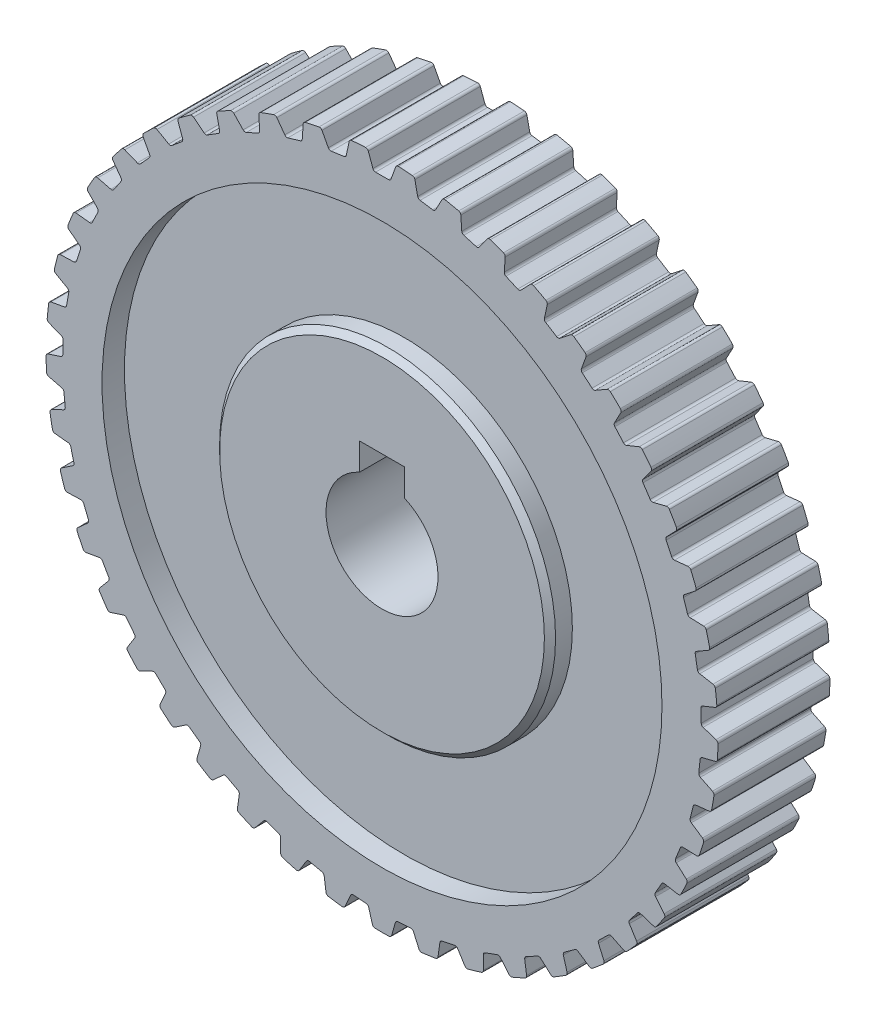
from build123d import *

# Parameters (mm, degrees)
SKETCH1_R               = 30
BOSS_EXTRUDE1_DEPTH     = 10
CUT_EXTRUDE1_DEPTH      = 44.588989435
CIRPATTERN1_COUNT       = 45
SKETCH3_R               = 25
SKETCH3_R_2             = 15
CUT_EXTRUDE_THIN1_DEPTH = 2
CHAMFER1_SIZE           = 0.5
CHAMFER2_SIZE           = 0.5
FILLET1_R               = 0.25


with BuildPart() as part:
    # Sketch1 → Boss-Extrude1 (new body)
    with BuildSketch(Plane.XY):
        Circle(SKETCH1_R)
        with BuildLine():
            Line((2, 7), (-2, 7))
            Line((-2, 7), (-2, 4.582575695))
            ThreePointArc((-2, 4.582575695), (0, -5), (2, 4.582575695))
            Line((2, 4.582575695), (2, 7))
        make_face(mode=Mode.SUBTRACT)
    extrude(amount=BOSS_EXTRUDE1_DEPTH)

    # Sketch2 → Cut-Extrude1 (cut, through all)
    with BuildSketch(Plane.XY.offset(10)):
        with BuildLine():
            Line((-0.75, 28.5), (0.75, 28.5))
            Line((0.75, 28.5), (1.285919783, 29.972427501))
            ThreePointArc((1.285919783, 29.972427501), (0, 30), (-1.285919783, 29.972427501))
            Line((-1.285919783, 29.972427501), (-0.75, 28.5))
        make_face()
    cut_extrude1 = extrude(amount=-CUT_EXTRUDE1_DEPTH, mode=Mode.SUBTRACT)

    # CirPattern1: Cut-Extrude1 ×45 about axis
    cirpattern1_axis = Axis((0, 0, 10), (0, 0, 1))
    for i in range(1, CIRPATTERN1_COUNT):
        add(cut_extrude1.rotate(cirpattern1_axis, i * 360 / CIRPATTERN1_COUNT), mode=Mode.SUBTRACT)

    # Sketch3 → Cut-Extrude-Thin1 (cut)
    with BuildSketch(Plane.XY.offset(10)):
        Circle(SKETCH3_R)
        Circle(SKETCH3_R_2, mode=Mode.SUBTRACT)
    cut_extrude_thin1 = extrude(amount=-CUT_EXTRUDE_THIN1_DEPTH, mode=Mode.SUBTRACT)

    # Chamfer1
    chamfer1_edges = [part.edges().sort_by_distance(p)[0] for p in [
        (-15, 0, 10),
    ]]
    chamfer(chamfer1_edges, length=CHAMFER1_SIZE)

    # Mirror1: Cut-Extrude-Thin1 across plane
    add(cut_extrude_thin1.mirror(Plane.XY.offset(5)), mode=Mode.SUBTRACT)

    # Chamfer2
    chamfer2_edges = [part.edges().sort_by_distance(p)[0] for p in [
        (-15, 0, 0),
    ]]
    chamfer(chamfer2_edges, length=CHAMFER2_SIZE)

    # Fillet1
    fillet1_edges = [part.edges().sort_by_distance(p)[0] for p in [
        (29.942650626, -1.854096408, 5),
        (29.999047061, -0.2391138, 5),
        (28.508813193, 0.245092536, 5),
        (28.456463948, 1.744178776, 5),
        (29.909291155, 2.33115907, 5),
        (29.740376607, 3.938273644, 5),
        (28.197257094, 4.210367249, 5),
        (27.936784828, 5.687578878, 5),
        (29.293781353, 6.471041187, 5),
        (28.90284355, 8.039007072, 5),
        (27.33687346, 8.093691952, 5),
        (26.873347969, 9.520276727, 5),
        (28.108101418, 10.484971849, 5),
        (27.502749521, 11.983270371, 5),
        (25.94440868, 11.819482149, 5),
        (25.286851959, 13.167673218, 5),
        (26.375329261, 14.29482446, 5),
        (25.567345756, 15.694292943, 5),
        (24.046965495, 15.31521957, 5),
        (23.20817614, 16.558775928, 5),
        (24.129191322, 17.826444573, 5),
        (23.134302688, 19.099843956, 5),
        (21.681475481, 18.512863662, 5),
        (20.677779571, 19.6275809, 5),
        (21.413406121, 21.01109322, 5),
        (20.250976734, 22.133638231, 5),
        (18.893980208, 21.350175922, 5),
        (17.744913544, 22.314357336, 5),
        (18.280833326, 23.786784837, 5),
        (16.973488552, 24.736626415, 5),
        (15.738735103, 23.771931292, 5),
        (14.466662959, 24.566810189, 5),
        (14.792444905, 26.099493745, 5),
        (13.365630723, 26.858144303, 5),
        (12.277153421, 25.730993061, 5),
        (10.906835234, 26.341098025, 5),
        (11.01613837, 27.904205694, 5),
        (9.497626095, 28.456898963, 5),
        (8.576610913, 27.189230317, 5),
        (7.134718369, 27.602686351, 5),
        (5.444760978, 29.501772453, 5),
        (4.709134429, 28.118260133, 5),
        (3.223732326, 28.327019785, 5),
        (2.897950379, 29.859703341, 5),
        (1.285919783, 29.972427501, 5),
        (0.75, 28.5, 5),
        (-0.75, 28.5, 5),
        (-1.285919783, 29.972427501, 5),
        (-2.897950379, 29.859703341, 5),
        (-3.223732326, 28.327019785, 5),
        (-4.709134429, 28.118260133, 5),
        (-5.444760978, 29.501772453, 5),
        (-7.025415233, 29.16579402, 5),
        (-7.134718369, 27.602686351, 5),
        (-8.576610913, 27.189230317, 5),
        (-9.497626095, 28.456898963, 5),
        (-11.01613837, 27.904205694, 5),
        (-10.906835234, 26.341098025, 5),
        (-12.277153421, 25.730993061, 5),
        (-13.365630723, 26.858144303, 5),
        (-14.792444905, 26.099493745, 5),
        (-14.466662959, 24.566810189, 5),
        (-15.738735103, 23.771931292, 5),
        (-16.973488552, 24.736626415, 5),
        (-18.280833326, 23.786784837, 5),
        (-17.744913544, 22.314357336, 5),
        (-18.893980208, 21.350175922, 5),
        (-20.250976734, 22.133638231, 5),
        (-21.413406121, 21.01109322, 5),
        (-20.677779571, 19.6275809, 5),
        (-21.681475481, 18.512863662, 5),
        (-23.134302688, 19.099843956, 5),
        (-24.129191322, 17.826444573, 5),
        (-23.20817614, 16.558775928, 5),
        (-24.046965495, 15.31521957, 5),
        (-25.567345756, 15.694292943, 5),
        (-26.375329261, 14.29482446, 5),
        (-25.286851959, 13.167673218, 5),
        (-25.94440868, 11.819482149, 5),
        (-27.502749521, 11.983270371, 5),
        (-28.108101418, 10.484971849, 5),
        (-26.873347969, 9.520276727, 5),
        (-27.33687346, 8.093691952, 5),
        (-28.90284355, 8.039007072, 5),
        (-29.293781353, 6.471041187, 5),
        (-27.936784828, 5.687578878, 5),
        (-28.197257094, 4.210367249, 5),
        (-29.740376607, 3.938273644, 5),
        (-29.909291155, 2.33115907, 5),
        (-28.456463948, 1.744178776, 5),
        (-28.508813193, 0.245092536, 5),
        (-29.999047061, -0.2391138, 5),
        (-29.942650626, -1.854096408, 5),
        (-28.422270365, -2.233169782, 5),
        (-28.265477671, -3.724952625, 5),
        (-29.673820188, -4.411847167, 5),
        (-29.393210462, -6.003264007, 5),
        (-27.834869621, -6.16705223, 5),
        (-27.471986777, -7.622495819, 5),
        (-28.771026159, -8.498708946, 5),
        (-28.27166489, -10.035584902, 5),
        (-26.7056948, -9.980900021, 5),
        (-26.14378491, -11.371675803, 5),
        (-27.308236832, -12.420153023, 5),
        (-26.59984352, -13.872574552, 5),
        (-25.056724008, -13.600480947, 5),
        (-24.306724008, -14.899519053, 5),
        (-25.313923738, -16.099852949, 5),
        (-24.410286453, -17.439550318, 5),
        (-22.920052584, -16.955343982, 5),
        (-21.996560371, -18.137360112, 5),
        (-22.826903912, -19.466187551, 5),
        (-21.745610926, -20.667085074, 5),
        (-20.337268408, -19.980190532, 5),
        (-19.258258708, -21.022178087, 5),
        (-19.895584367, -22.453634955, 5),
        (-18.657681818, -23.492358527, 5),
        (-17.358642436, -22.6161454, 5),
        (-16.145116945, -23.497823279, 5),
        (-16.577019903, -25.004047895, 5),
        (-15.206602156, -25.860379944, 5),
        (-14.042150234, -24.811902724, 5),
        (-12.717728845, -25.516110069, 5),
        (-12.935802603, -27.067785484, 5),
        (-11.45954328, -27.725058482, 5),
        (-10.45234355, -26.524724585, 5),
        (-9.042804619, -27.0377548, 5),
        (-9.042804619, -28.604679418, 5),
        (-7.48943743, -29.050100292, 5),
        (-6.659093889, -27.721272853, 5),
        (-5.191872488, -28.033140389, 5),
        (-4.97379873, -29.584815805, 5),
        (-3.373558199, -29.809714945, 5),
        (-2.736232539, -28.378258077, 5),
        (-1.239886464, -28.482892788, 5),
        (-0.807983505, -29.989117404, 5),
        (0.807983505, -29.989117404, 5),
        (1.239886464, -28.482892788, 5),
        (2.736232539, -28.378258077, 5),
        (3.373558199, -29.809714945, 5),
        (4.97379873, -29.584815805, 5),
        (5.191872488, -28.033140389, 5),
        (6.659093889, -27.721272853, 5),
        (7.48943743, -29.050100292, 5),
        (9.042804619, -28.604679418, 5),
        (9.042804619, -27.0377548, 5),
        (10.45234355, -26.524724585, 5),
        (11.45954328, -27.725058482, 5),
        (12.935802603, -27.067785484, 5),
        (12.717728845, -25.516110069, 5),
        (14.042150234, -24.811902724, 5),
        (15.206602156, -25.860379944, 5),
        (16.577019903, -25.004047895, 5),
        (16.145116945, -23.497823279, 5),
        (17.358642436, -22.6161454, 5),
        (18.657681818, -23.492358527, 5),
        (19.895584367, -22.453634955, 5),
        (19.258258708, -21.022178087, 5),
        (20.337268408, -19.980190532, 5),
        (21.745610926, -20.667085074, 5),
        (22.826903912, -19.466187551, 5),
        (21.996560371, -18.137360112, 5),
        (22.920052584, -16.955343982, 5),
        (24.410286453, -17.439550318, 5),
        (25.313923738, -16.099852949, 5),
        (24.306724008, -14.899519053, 5),
        (25.056724008, -13.600480947, 5),
        (26.59984352, -13.872574552, 5),
        (27.308236832, -12.420153023, 5),
        (26.14378491, -11.371675803, 5),
        (26.7056948, -9.980900021, 5),
        (28.27166489, -10.035584902, 5),
        (28.771026159, -8.498708946, 5),
        (27.471986777, -7.622495819, 5),
        (27.834869621, -6.16705223, 5),
        (29.393210462, -6.003264007, 5),
        (29.673820188, -4.411847167, 5),
        (28.265477671, -3.724952625, 5),
        (28.422270365, -2.233169782, 5),
        (7.025415233, 29.16579402, 5),
    ]]
    fillet(fillet1_edges, radius=FILLET1_R)


solid = part.part
